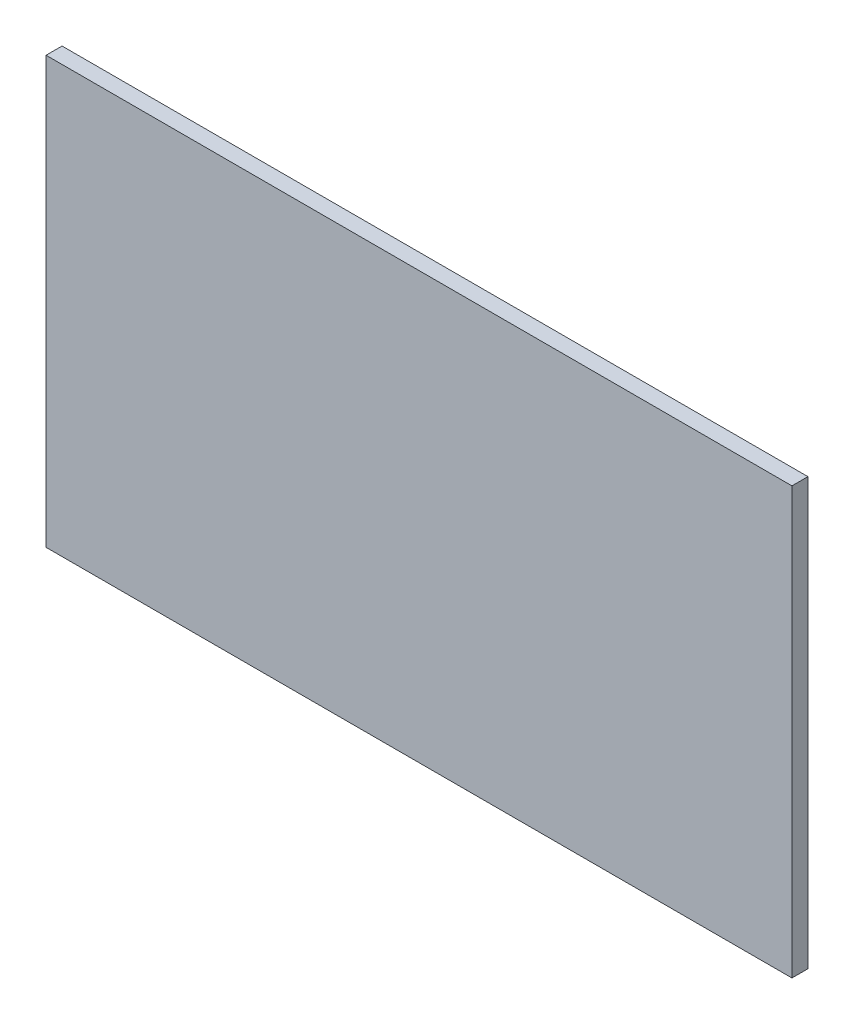
from build123d import *

# Parameters (mm, degrees)
SKETCH_1_W             = 70
SKETCH_1_H             = 40
SM_BASE_FLANGE_1_DEPTH = 1.5


# Sheet-metal steps are written as plain solids
with BuildPart() as part:
    # Sketch 1 → 基体-法兰1 (new body)
    with BuildSketch(Plane.XY):
        Rectangle(SKETCH_1_W, SKETCH_1_H)
    extrude(amount=-SM_BASE_FLANGE_1_DEPTH)


solid = part.part
